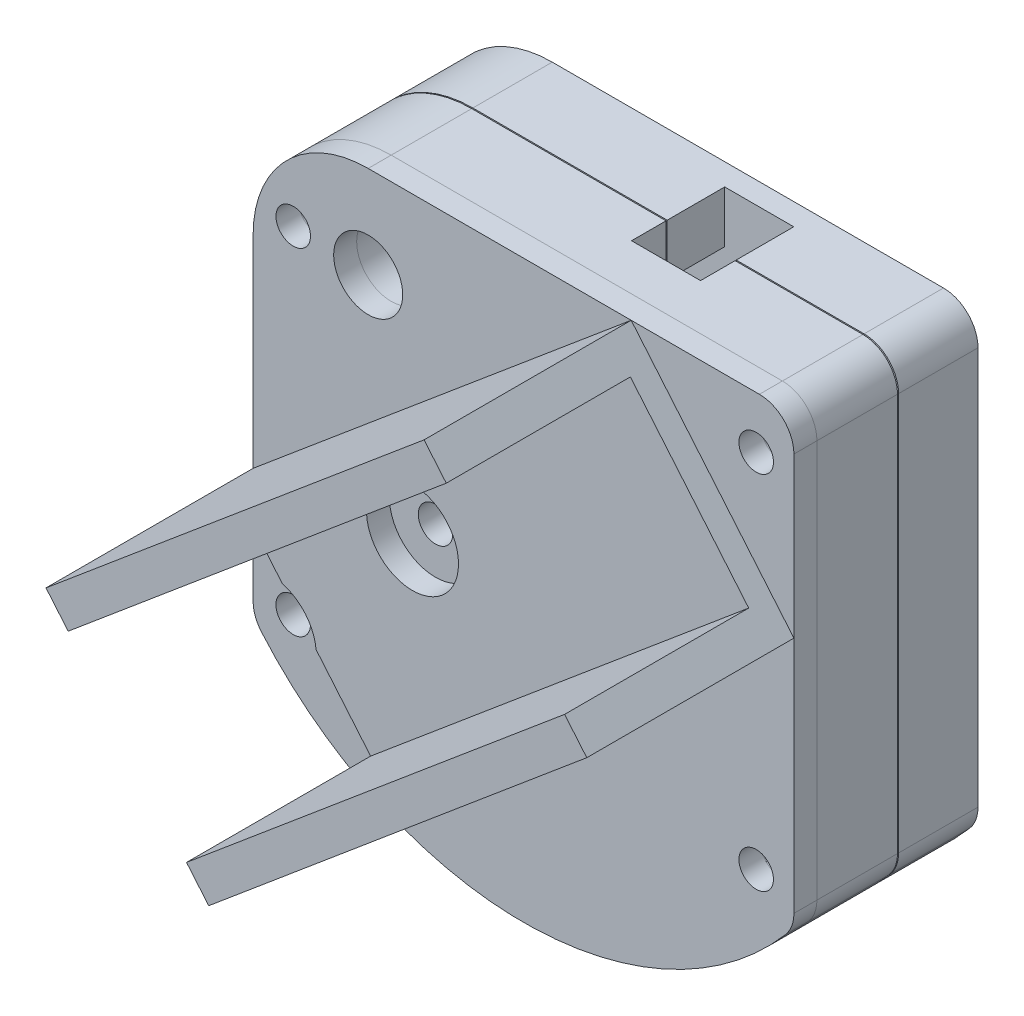
from build123d import *

# Parameters (mm, degrees)
BOSS_EXTRUDE1_DEPTH      = 4
BOSS_EXTRUDE1_DEPTH_BACK = 10
SKETCH1_W                = 47
SKETCH1_H                = 50
SKETCH2_R                = 3.25
CUT_EXTRUDE1_DEPTH       = 34
CUT_EXTRUDE2_DEPTH       = 34
FILLET6_R                = 3
CUT_EXTRUDE3_DEPTH       = 51.924087289
CUT_EXTRUDE3_DEPTH_BACK  = 51.924087289
SKETCH5_W                = 79.114310325
SKETCH5_H                = 0.1
BOSS_EXTRUDE2_DEPTH      = 3
SKETCH7_R                = 3.35
CUT_EXTRUDE4_DEPTH       = 47.360140908
CUT_EXTRUDE5_DEPTH       = 60.103829557
CUT_EXTRUDE5_DEPTH_BACK  = 60.103829557
SKETCH8_W                = 47
SKETCH8_H                = 3
CHAMFER1_SIZE            = 10.989909678
CHAMFER1_SIZE_2          = 4
CUT_EXTRUDE6_START       = -10.98991
CUT_EXTRUDE6_DEPTH       = 10.98991
BOSS_EXTRUDE3_REACH      = 78.318
BOSS_EXTRUDE3_END_RADIUS = 30
BOSS_EXTRUDE3_START      = 25
SKETCH11_W               = 21.225
SKETCH11_H               = 1.9
CUT_EXTRUDE8_DEPTH       = 5
BOSS_EXTRUDE4_DEPTH      = 20
FILLET1_R                = 10
BOSS_EXTRUDE5_DEPTH      = 2
SKETCH16_W               = 16
SKETCH16_H               = 16
CUT_EXTRUDE9_DEPTH       = 59.938302942
SKETCH17_R               = 1.5
CUT_EXTRUDE10_DEPTH      = 54.077892425
SKETCH10_R               = 3
CUT_EXTRUDE7_DEPTH       = 10
FILLET2_R                = 10
FILLET3_R                = 3
FILLET4_R                = 3
FILLET5_R                = 3
SKETCH18_R               = 4
CUT_EXTRUDE11_DEPTH      = 2


with BuildPart() as part:
    # Sketch1 → Boss-Extrude1 (new, two sides: drawn at the far end of the back side and taken through both)
    with BuildSketch(Plane.XY.offset(-BOSS_EXTRUDE1_DEPTH_BACK)):
        with Locations((-6.3875, -15)):
            Rectangle(SKETCH1_W, SKETCH1_H)
    extrude(amount=BOSS_EXTRUDE1_DEPTH + BOSS_EXTRUDE1_DEPTH_BACK)

    # Sketch2 → Cut-Extrude1 (cut)
    with BuildSketch(Plane.XZ.offset(40)):
        with Locations((-19.8875, -3)):
            Circle(SKETCH2_R)
    extrude(amount=-CUT_EXTRUDE1_DEPTH, mode=Mode.SUBTRACT)

    # Sketch3 → Cut-Extrude2 (cut)
    with BuildSketch(Plane.XY.offset(4)):
        with BuildLine():
            ThreePointArc((-6.3875, -40), (-19.436605602, -37.013345646), (-29.8875, -28.648056199))
            Line((-29.8875, -28.648056199), (-29.8875, -40))
            Line((-29.8875, -40), (-6.3875, -40))
        make_face()
        with BuildLine():
            ThreePointArc((17.1125, -28.648056199), (6.661605602, -37.013345646), (-6.3875, -40))
            Line((-6.3875, -40), (17.1125, -40))
            Line((17.1125, -40), (17.1125, -28.648056199))
        make_face()
    extrude(amount=-CUT_EXTRUDE2_DEPTH, mode=Mode.SUBTRACT)

    # Fillet6
    fillet6_edges = [part.edges().sort_by_distance(p)[0] for p in [
        (-29.8875, -28.648056199, -3),
        (17.1125, -28.648056199, -3),
    ]]
    fillet(fillet6_edges, radius=FILLET6_R)

    # Sketch5 → Cut-Extrude3 (cut, two sides: drawn at the far end of the back side and taken through both)
    with BuildSketch(Plane(origin=(0, 0, 0), x_dir=(1, 0, 0), z_dir=(0, 1, 0)).offset(-CUT_EXTRUDE3_DEPTH_BACK)):
        with Locations((-3.340175776, 0.05)):
            Rectangle(SKETCH5_W, SKETCH5_H)
    extrude(amount=CUT_EXTRUDE3_DEPTH + CUT_EXTRUDE3_DEPTH_BACK, mode=Mode.SUBTRACT)


with BuildPart() as cut_extrude3_piece_1:
    # of the separate pieces the step leaves, piece 1, a body of its own (cut_extrude3_pieces)
    add(part.part.solids().sort_by_distance((17.1125, -27.571283391, -10))[0])

    # Sketch8 → Cut-Extrude5 (cut, two sides: drawn at the far end of the back side and taken through both)
    with BuildSketch(Plane(origin=(0, 10, 0), x_dir=(1, 0, 0), z_dir=(0, 1, 0)).offset(-CUT_EXTRUDE5_DEPTH_BACK)):
        with Locations((-6.3875, 1.6)):
            Rectangle(SKETCH8_W, SKETCH8_H)
    extrude(amount=CUT_EXTRUDE5_DEPTH + CUT_EXTRUDE5_DEPTH_BACK, mode=Mode.SUBTRACT)

    # Chamfer1
    # the kernel refuses this chamfer: 10.989909678, 4 mm, written as the material it takes off along each edge
    with BuildSketch(Plane(origin=(11.870926972, -6, -3.1), x_dir=(0, 0.9999130865277316, 0.013184058198645774), z_dir=(-1, 0, 0))) as chamfer1_piece_1_section:
        Polygon((CHAMFER1_SIZE * 0.999913086511, CHAMFER1_SIZE * 0.0131840581984), (-CHAMFER1_SIZE_2 * 0.0131840581986, CHAMFER1_SIZE_2 * 0.999913086528), (0, 0), align=None)
    chamfer1_piece_1 = extrude(amount=63.516853943, mode=Mode.PRIVATE)
    chamfer1_piece_1 = chamfer1_piece_1 & Plane(origin=(-19.8875, -1.979890476, -3), x_dir=(1, 0, 0), z_dir=(0, -1, 0)) * Cylinder(3.25, 171, mode=Mode.PRIVATE)
    add(chamfer1_piece_1, mode=Mode.SUBTRACT)

    # Boss-Extrude3: up to this cylinder (the profile starts inside it)
    boss_extrude3_end = Plane(origin=(-6.3875, -10, -2.15), z_dir=(0, 0, 1)) * Cylinder(BOSS_EXTRUDE3_END_RADIUS, 217.636, mode=Mode.PRIVATE)
    # Sketch11 → Boss-Extrude3 (add, up to the surface)
    with BuildSketch(Plane.XZ.offset(-0.5).offset(BOSS_EXTRUDE3_START), mode=Mode.PRIVATE) as boss_extrude3_sk1:
        with Locations((0, -2.15)):
            Rectangle(SKETCH11_W, SKETCH11_H)
    boss_extrude3_tool1 = extrude(boss_extrude3_sk1.sketch, amount=BOSS_EXTRUDE3_REACH, mode=Mode.PRIVATE) & boss_extrude3_end
    add(boss_extrude3_tool1.solids().sort_by_distance((0, -24.5, -2.15))[0])

    # Sketch12 → Cut-Extrude8 (cut)
    with BuildSketch(Plane.XY.offset(-3.1)):
        Polygon((-11.6125, 0.5), (-11.6125, -8), (11.6125, -8), (11.6125, 0.5), (7.4, 0.5), (7.4, 5.5), (3, 5.5), (3, 10), (-3, 10), (-3, 5.5), (-7.4, 5.5), (-7.4, 0.5), align=None)
    extrude(amount=-CUT_EXTRUDE8_DEPTH, mode=Mode.SUBTRACT)


with BuildPart() as cut_extrude3_piece_2:
    # of the separate pieces the step leaves, piece 2, a body of its own (cut_extrude3_pieces)
    add(part.part.solids().sort_by_distance((17.1125, 10, 0))[0])

    # Sketch6 → Boss-Extrude2 (add)
    with BuildSketch(Plane(origin=(0, 0, 0), x_dir=(-1, 0, 0), z_dir=(0, 0, -1))):
        with BuildLine():
            Line((-3, 10), (-17.1125, 10))
            Line((-17.1125, 10), (-17.1125, -27.571283391))
            ThreePointArc((-17.1125, -27.571283391), (-16.926157169, -28.612116391), (-16.390277778, -29.523648212))
            ThreePointArc((-16.390277778, -29.523648212), (-14.123868103, -31.892550755), (-11.6125, -34))
            Line((-11.6125, -34), (-11.6125, -22.145677649))
            ThreePointArc((-11.6125, -22.145677649), (-10.25, -20.25), (-11.6125, -18.354322351))
            Line((-11.6125, -18.354322351), (-11.6125, 0.5))
            Line((-11.6125, 0.5), (-7.4, 0.5))
            Line((-7.4, 0.5), (-7.4, 5.5))
            Line((-7.4, 5.5), (-3, 5.5))
            Line((-3, 5.5), (-3, 10))
        make_face()
        with BuildLine():
            Line((3, 10), (3, 5.5))
            Line((3, 5.5), (7.4, 5.5))
            Line((7.4, 5.5), (7.4, 0.5))
            Line((7.4, 0.5), (11.6125, 0.5))
            Line((11.6125, 0.5), (11.6125, -18.354322351))
            ThreePointArc((11.6125, -18.354322351), (10.25, -20.25), (11.6125, -22.145677649))
            Line((11.6125, -22.145677649), (11.6125, -39.54148566))
            ThreePointArc((11.6125, -39.54148566), (15.191279196, -38.679146987), (18.6375, -37.384986763))
            Line((18.6375, -37.384986763), (18.6375, -6))
            Line((18.6375, -6), (21.1375, -6))
            Line((21.1375, -6), (21.1375, -36.123504742))
            ThreePointArc((21.1375, -36.123504742), (25.439351689, -33.173841874), (29.165277778, -29.523648212))
            ThreePointArc((29.165277778, -29.523648212), (29.701157169, -28.612116391), (29.8875, -27.571283391))
            Line((29.8875, -27.571283391), (29.8875, 10))
            Line((29.8875, 10), (3, 10))
        make_face()
    extrude(amount=BOSS_EXTRUDE2_DEPTH)

    # Sketch7 → Cut-Extrude4 (cut, through all)
    with BuildSketch(Plane.XZ.offset(6)):
        with Locations((-19.895143437, -2.900292539)):
            Circle(SKETCH7_R)
    extrude(amount=CUT_EXTRUDE4_DEPTH, mode=Mode.SUBTRACT)

    # Sketch9 → Cut-Extrude6 (cut)
    with BuildSketch(Plane.XZ.offset(6).offset(CUT_EXTRUDE6_START)):
        with BuildLine():
            Line((-23.243659291, -3), (-16.546627584, -3))
            ThreePointArc((-16.546627584, -3), (-19.895143437, 0.449707461), (-23.243659291, -3))
        make_face()
    extrude(amount=CUT_EXTRUDE6_DEPTH, mode=Mode.SUBTRACT)

    # Fillet1
    fillet1_edges = [cut_extrude3_piece_2.edges().sort_by_distance(p)[0] for p in [
        (-29.8875, 10, 0.5),
    ]]
    fillet(fillet1_edges, radius=FILLET1_R)


with BuildPart() as body_3:
    # Sketch13 → Boss-Extrude4 (new body)
    with BuildSketch(Plane.XY.offset(4)):
        Polygon((17.1125, -6.852977749), (2.971172587, 10), (-29.8875, -17.571700049), (-15.746172587, -34.424677797), align=None)
    extrude(amount=BOSS_EXTRUDE4_DEPTH)

    # Sketch15 → Boss-Extrude5 (add)
    with BuildSketch(Plane.XY.offset(4)):
        with BuildLine():
            Line((17.1125, 10), (-19.8875, 10))
            ThreePointArc((-19.8875, 10), (-26.958567812, 7.071067812), (-29.8875, 0))
            Line((-29.8875, 0), (-29.8875, -27.571283391))
            ThreePointArc((-29.8875, -27.571283391), (-29.701157169, -28.612116391), (-29.165277778, -29.523648212))
            ThreePointArc((-29.165277778, -29.523648212), (-6.3875, -40), (16.390277778, -29.523648212))
            ThreePointArc((16.390277778, -29.523648212), (16.926157169, -28.612116391), (17.1125, -27.571283391))
            Line((17.1125, -27.571283391), (17.1125, 10))
        make_face()
    extrude(amount=BOSS_EXTRUDE5_DEPTH)

    # Sketch16 → Cut-Extrude9 (cut, through all)
    with BuildSketch(Plane(origin=(-26.191078176, -21.976924037, 0), x_dir=(0, 0, 1), z_dir=(-0.7660444431189749, -0.642787609686543, 0))):
        with Locations((16, -5.249388494)):
            Rectangle(SKETCH16_W, SKETCH16_H)
    extrude(amount=-CUT_EXTRUDE9_DEPTH, mode=Mode.SUBTRACT)


with BuildPart() as cut_extrude10_tool:
    # Sketch17 → Cut-Extrude10 (new, through all)
    with BuildSketch(Plane.XY.offset(6)):
        with Locations((13.836012781, -25.897644193)):
            Circle(SKETCH17_R)
        with Locations((-14.036807943, -13.847364557)):
            Circle(SKETCH17_R)
        with Locations((-26.401442701, 2.394316693)):
            Circle(SKETCH17_R)
        with Locations((13.836012781, 5.5)):
            Circle(SKETCH17_R)
        with Locations((-26.401442701, -26.840709556)):
            Circle(SKETCH17_R)
    extrude(amount=-CUT_EXTRUDE10_DEPTH)


with BuildPart() as cut_extrude3_piece_1_1:
    add(cut_extrude3_piece_1.part)

    # Cut-Extrude10: cut by cut_extrude10_tool
    add(cut_extrude10_tool.part, mode=Mode.SUBTRACT)

    # Fillet2
    fillet2_edges = [cut_extrude3_piece_1_1.edges().sort_by_distance(p)[0] for p in [
        (-29.8875, 10, -6.55),
    ]]
    fillet(fillet2_edges, radius=FILLET2_R)

    # Fillet3
    fillet3_edges = [cut_extrude3_piece_1_1.edges().sort_by_distance(p)[0] for p in [
        (17.1125, 10, -6.55),
    ]]
    fillet(fillet3_edges, radius=FILLET3_R)


with BuildPart() as cut_extrude3_piece_2_1:
    add(cut_extrude3_piece_2.part)

    # Cut-Extrude10: cut by cut_extrude10_tool
    add(cut_extrude10_tool.part, mode=Mode.SUBTRACT)


with BuildPart() as body_3_1:
    add(body_3.part)

    # Cut-Extrude10: cut by cut_extrude10_tool
    add(cut_extrude10_tool.part, mode=Mode.SUBTRACT)


with BuildPart() as cut_extrude7_tool:
    # Sketch10 → Cut-Extrude7 (new body)
    with BuildSketch(Plane.XY.offset(-3.1)):
        with Locations(Location((-19.8875, 1.989909678, 0), (0, 0, 180))):
            Circle(SKETCH10_R)
    extrude(amount=CUT_EXTRUDE7_DEPTH)


with BuildPart() as cut_extrude3_piece_2_2:
    add(cut_extrude3_piece_2_1.part)

    # Cut-Extrude7: cut by cut_extrude7_tool
    add(cut_extrude7_tool.part, mode=Mode.SUBTRACT)

    # Fillet4
    fillet4_edges = [cut_extrude3_piece_2_2.edges().sort_by_distance(p)[0] for p in [
        (17.1125, 10, 0.5),
    ]]
    fillet(fillet4_edges, radius=FILLET4_R)


with BuildPart() as body_3_2:
    add(body_3_1.part)

    # Cut-Extrude7: cut by cut_extrude7_tool
    add(cut_extrude7_tool.part, mode=Mode.SUBTRACT)

    # Fillet5
    fillet5_edges = [body_3_2.edges().sort_by_distance(p)[0] for p in [
        (17.1125, 10, 5),
    ]]
    fillet(fillet5_edges, radius=FILLET5_R)

    # Sketch18 → Cut-Extrude11 (cut)
    with BuildSketch(Plane.XY.offset(8)):
        with Locations((-14.036807943, -13.847364557)):
            Circle(SKETCH18_R)
        with Locations((-26.401442701, -26.840709556)):
            Circle(SKETCH18_R)
    extrude(amount=-CUT_EXTRUDE11_DEPTH, mode=Mode.SUBTRACT)


solid = Compound([cut_extrude3_piece_1_1.part, cut_extrude3_piece_2_2.part, body_3_2.part])
